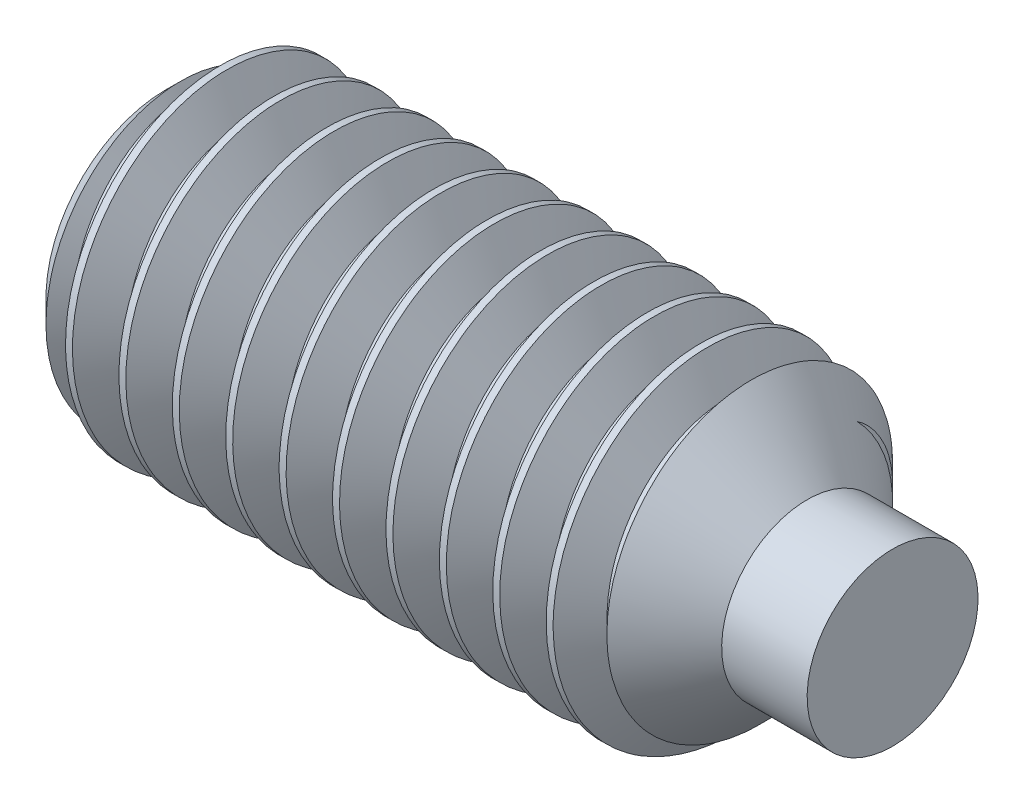
from build123d import *

# Parameters (mm, degrees)
SKETCH3_W          = 1.6
SKETCH3_H          = 0.8
CUT_EXTRUDE1_DEPTH = 0.9375
CUT_SWEEP1_PITCH   = 0.5


with BuildPart() as part:
    # Sketch3 → Revolve1 (revolve)
    with BuildSketch(Plane.XY, mode=Mode.PRIVATE) as revolve1_sk:
        with Locations((2.6, 0.4)):
            Rectangle(SKETCH3_W, SKETCH3_H)
    revolve(revolve1_sk.sketch.rotate(Axis((-3.4, 0, 0), (1, 0, 0)), 180), axis=Axis((-3.4, 0, 0), (1, 0, 0)))


with BuildPart() as body_2:
    # Sketch4 → Revolve2 (revolve)
    with BuildSketch(Plane.XY, mode=Mode.PRIVATE) as revolve2_sk:
        Polygon((2.6, 0.8), (1.9, 1.5), (-3.025, 1.5), (-3.4, 1.125), (-3.4, 0), (1.8, 0), (1.8, 0.8), align=None)
    revolve(revolve2_sk.sketch.rotate(Axis((-3.4, 0, 0), (1, 0, 0)), 180), axis=Axis((-3.4, 0, 0), (1, 0, 0)))

    # Sketch5 → Cut-Extrude1 (cut)
    with BuildSketch(Plane.ZY.offset(3.4)):
        Polygon((0, 0.866025404), (-0.75, 0.433012702), (-0.75, -0.433012702), (0, -0.866025404), (0.75, -0.433012702), (0.75, 0.433012702), align=None)
    extrude(amount=-CUT_EXTRUDE1_DEPTH, mode=Mode.SUBTRACT)

    # Cut-Extrude2 cone 1 section (through the dimple's axis) → Cut-Extrude2 (revolve, cut)
    with BuildSketch(Plane(origin=(-3.4, 0, 0), x_dir=(0, 0, 1), z_dir=(0, 1, 0))):
        Polygon((0, 0), (0.866025404, 0), (0, 0.866025404), align=None)
    revolve(axis=Axis((-3.4, 0, 0), (1, 0, 0)), mode=Mode.SUBTRACT)

    # Cut-Sweep1: the profile of Sketch7 screwed along a right-hand helix of 13 turns, 6 arcs to a turn; built about Z, then put on its axis
    cut_sweep1_z = Axis((0, 0, 0), (0, 0, 1))
    cut_sweep1_corners = [(1.179570601, 0, -0.185), (1.179570601, 0, -0.25), (1.528145826, 0, -0.45125), (1.528145826, 0, 0.01625)]
    with BuildLine(mode=Mode.PRIVATE) as cut_sweep1_profile:
        Line(cut_sweep1_corners[0], cut_sweep1_corners[1])
        Line(cut_sweep1_corners[1], cut_sweep1_corners[2])
        Line(cut_sweep1_corners[2], cut_sweep1_corners[3])
        Line(cut_sweep1_corners[3], cut_sweep1_corners[0])
    cut_sweep1_cap = Face(cut_sweep1_profile.wire())
    cut_sweep1_turn_angles = [0, 30, 60, 90, 120, 150, 180, 210, 240, 270, 300, 330, 360]
    cut_sweep1_turn_weights = [1, 0.8660254037844387, 1, 0.8660254037844387, 1, 0.8660254037844387, 1, 0.8660254037844387, 1, 0.8660254037844387, 1, 0.8660254037844387, 1]
    cut_sweep1_turn_rails = [Edge.make_bspline([Vector(p[0], p[1], 0).rotate(cut_sweep1_z, cut_sweep1_turn_angles[k]) / cut_sweep1_turn_weights[k] + Vector(0, 0, p[2] + CUT_SWEEP1_PITCH * cut_sweep1_turn_angles[k] / 360) for k in range(13)], [0, 0, 0, 1, 1, 2, 2, 3, 3, 4, 4, 5, 5, 6, 6, 6], 2, cut_sweep1_turn_weights) for p in cut_sweep1_corners]
    cut_sweep1_turn_sides = [Face.make_surface_from_curves(cut_sweep1_turn_rails[p[0]], cut_sweep1_turn_rails[p[1]]) for p in [(0, 1), (1, 2), (2, 3), (3, 0)]]
    cut_sweep1 = Plane(origin=(2.6, 0, 0), x_dir=(0, 1, 0), z_dir=(-1, 0, 0)) * Solid(Shell([*[p.moved(Location((0, 0, CUT_SWEEP1_PITCH * i))) for i in range(13) for p in cut_sweep1_turn_sides], cut_sweep1_cap, cut_sweep1_cap.rotate(cut_sweep1_z, 4680).moved(Location((0, 0, CUT_SWEEP1_PITCH * 4680 / 360)))]))
    add(cut_sweep1, mode=Mode.SUBTRACT)


solid = Compound([part.part, body_2.part])
